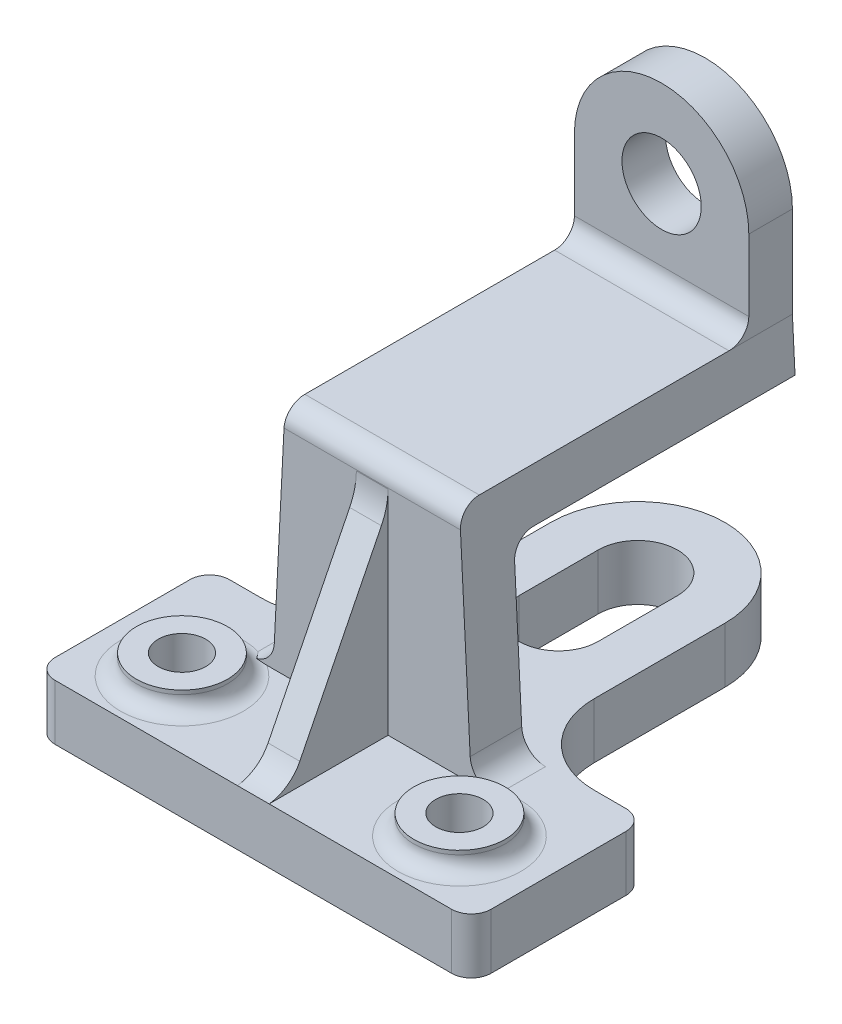
from build123d import *

# Parameters (mm, degrees)
SKETCH1_R           = 11.5
BOSS_EXTRUDE1_DEPTH = 14
SKETCH1_3_R         = 11.5
SKETCH1_3_R_2       = 6
BOSS_EXTRUDE2_DEPTH = 19
BOSS_EXTRUDE3_DEPTH = 4
SKETCH8_R           = 10
BOSS_EXTRUDE4_DEPTH = 11
FILLET1_R           = 10
FILLET2_R           = 16
FILLET10_R          = 5
FILLET8_R           = 4
FILLET9_START       = -43
FILLET9_DEPTH       = 13


with BuildPart() as part:
    # Sketch1 → Boss-Extrude1 (new body)
    with BuildSketch(Plane(origin=(0, 0, 0), x_dir=(1, 0, 0), z_dir=(0, 1, 0))):
        with BuildLine():
            Line((-77, 64), (-77, 97))
            ThreePointArc((-77, 97), (-55, 119), (-33, 97))
            Line((-33, 97), (-33, 64))
            ThreePointArc((-33, 64), (-27.142135624, 49.857864376), (-13, 44))
            Line((-13, 44), (-5, 44))
            ThreePointArc((-5, 44), (-1.464466094, 42.535533906), (0, 39))
            Line((0, 39), (0, 5))
            ThreePointArc((0, 5), (-1.464466094, 1.464466094), (-5, 0))
            Line((-5, 0), (-105, 0))
            ThreePointArc((-105, 0), (-108.535533906, 1.464466094), (-110, 5))
            Line((-110, 5), (-110, 39))
            ThreePointArc((-110, 39), (-108.535533906, 42.535533906), (-105, 44))
            Line((-105, 44), (-97, 44))
            ThreePointArc((-97, 44), (-82.857864376, 49.857864376), (-77, 64))
        make_face()
        with Locations(Location((-20, 17, 0), (0, 0, 270))):
            Circle(SKETCH1_R, mode=Mode.SUBTRACT)
        with Locations(Location((-90, 17, 0), (0, 0, 270))):
            Circle(SKETCH1_R, mode=Mode.SUBTRACT)
        with BuildLine():
            Line((-45, 97), (-45, 77))
            ThreePointArc((-45, 77), (-55, 67), (-65, 77))
            Line((-65, 77), (-65, 97))
            ThreePointArc((-65, 97), (-55, 107), (-45, 97))
        make_face(mode=Mode.SUBTRACT)
    extrude(amount=BOSS_EXTRUDE1_DEPTH)

    # Sketch1<3> → Boss-Extrude2 (add)
    # profile 1 of 2: a face of its own
    with BuildSketch(Plane(origin=(0, 0, 0), x_dir=(1, 0, 0), z_dir=(0, 1, 0))):
        with Locations(Location((-90, 17, 0), (0, 0, 270))):
            Circle(SKETCH1_3_R)
        with Locations(Location((-90, 17, 0), (0, 0, 270))):
            Circle(SKETCH1_3_R_2, mode=Mode.SUBTRACT)
    # profile 2 of 2: a face of its own
    with BuildSketch(Plane(origin=(0, 0, 0), x_dir=(1, 0, 0), z_dir=(0, 1, 0))):
        with Locations(Location((-20, 17, 0), (0, 0, 270))):
            Circle(SKETCH1_3_R)
        with Locations(Location((-20, 17, 0), (0, 0, 270))):
            Circle(SKETCH1_3_R_2, mode=Mode.SUBTRACT)
    extrude(amount=BOSS_EXTRUDE2_DEPTH)

    # Sketch3 → Loft1 section 0
    with BuildSketch(Plane(origin=(0, 73, 0), x_dir=(1, 0, 0), z_dir=(0, 1, 0))):
        with BuildLine():
            Line((-77, 43), (-33, 43))
            Line((-33, 43), (-33, 30))
            Line((-33, 30), (-77, 30))
            Line((-77, 30), (-77, 43))
        make_face()
    # Sketch2 → Loft1 section 1
    with BuildSketch(Plane(origin=(0, 14, 0), x_dir=(1, 0, 0), z_dir=(0, 1, 0))):
        with BuildLine():
            Line((-80, 43), (-30, 43))
            Line((-30, 43), (-30, 30))
            Line((-30, 30), (-80, 30))
            Line((-80, 30), (-80, 43))
        make_face()
    loft()

    # Sketch4 → Boss-Extrude3 (add, symmetric)
    with BuildSketch(Plane(origin=(-55, 0, 0), x_dir=(0, 0, -1), z_dir=(1, 0, 0))):
        Polygon((30, 64), (5, 14), (30, 14), align=None)
    extrude(amount=BOSS_EXTRUDE3_DEPTH, both=True)

    # Sketch7 → Loft2 section 0
    with BuildSketch(Plane(origin=(0, 0, -43), x_dir=(-1, 0, 0), z_dir=(0, 0, -1))):
        with BuildLine():
            Line((77, 73), (77.661016949, 60))
            Line((77.661016949, 60), (32.338983051, 60))
            Line((32.338983051, 60), (33, 73))
            Line((33, 73), (77, 73))
        make_face()
    # Sketch6 → Loft2 section 1
    with BuildSketch(Plane.XY.offset(-114)):
        with BuildLine():
            Line((-77, 73), (-77.661016949, 60))
            Line((-77.661016949, 60), (-32.338983051, 60))
            Line((-32.338983051, 60), (-33, 73))
            Line((-33, 73), (-77, 73))
        make_face()
    loft()

    # Sketch8 → Boss-Extrude4 (add)
    with BuildSketch(Plane.XY.offset(-114)):
        with BuildLine():
            Line((-77, 73), (-77, 96))
            ThreePointArc((-77, 96), (-55, 118), (-33, 96))
            Line((-33, 96), (-33, 73))
            Line((-33, 73), (-77, 73))
        make_face()
        with Locations((-55, 96)):
            Circle(SKETCH8_R, mode=Mode.SUBTRACT)
    extrude(amount=BOSS_EXTRUDE4_DEPTH)

    # Fillet1
    # the kernel refuses this fillet: 10 mm, written as the material it adds along each edge
    with BuildSketch(Plane(origin=(-59, 14, -5), x_dir=(0, 0, 1), z_dir=(1, 0, 0))) as fillet1_piece_1:
        with BuildLine():
            CenterArc((6.217538244, -9.925603288), FILLET1_R, 96.993331588, 56.441617235)
            Line((-2.726733666, -5.453467333), (-2.905619105, -5.364024614))
            Line((-2.905619105, -5.364024614), (-0.178885438, 0.089442719))
            Line((-0.178885438, 0.089442719), (0, 0.2))
            ThreePointArc((0, 0.2), (2.5, 0.2), (4.975649235, 0.198512066))
            Line((4.975649235, 0.198512066), (5, 0))
        make_face()
    extrude(amount=8)

    # Fillet2
    fillet2_edges = [part.edges().sort_by_distance(p)[0] for p in [
        (-55, 64, -30),
    ]]
    fillet(fillet2_edges, radius=FILLET2_R)

    # Fillet10
    fillet10_edges = [part.edges().sort_by_distance(p)[0] for p in [
        (-55, 60, -43),
        (-55, 73, -103),
        (-55, 73, -30),
    ]]
    fillet(fillet10_edges, radius=FILLET10_R)

    # Fillet8
    fillet8_edges = [part.edges().sort_by_distance(p)[0] for p in [
        (-90, 14, -28.5),
        (-20, 14, -28.5),
    ]]
    fillet(fillet8_edges, radius=FILLET8_R)

    # Fillet9: read off the stored shape, not the designer's step
    # Fillet9 outline → Fillet9 (add)
    with BuildSketch(Plane.XY.offset(FILLET9_START)):
        with BuildLine():
            Line((-80, 14), (-79.710408023, 19.695308884))
            ThreePointArc((-79.710408023, 19.695308884), (-81.56915401, 15.650968689), (-85.702666639, 14))
            Line((-85.702666639, 14), (-80, 14))
        make_face()
        with BuildLine():
            Line((-30.289591977, 19.695308884), (-30, 14))
            Line((-30, 14), (-24.297333361, 14))
            ThreePointArc((-24.297333361, 14), (-28.43084599, 15.650968689), (-30.289591977, 19.695308884))
        make_face()
    extrude(amount=FILLET9_DEPTH)


solid = part.part
